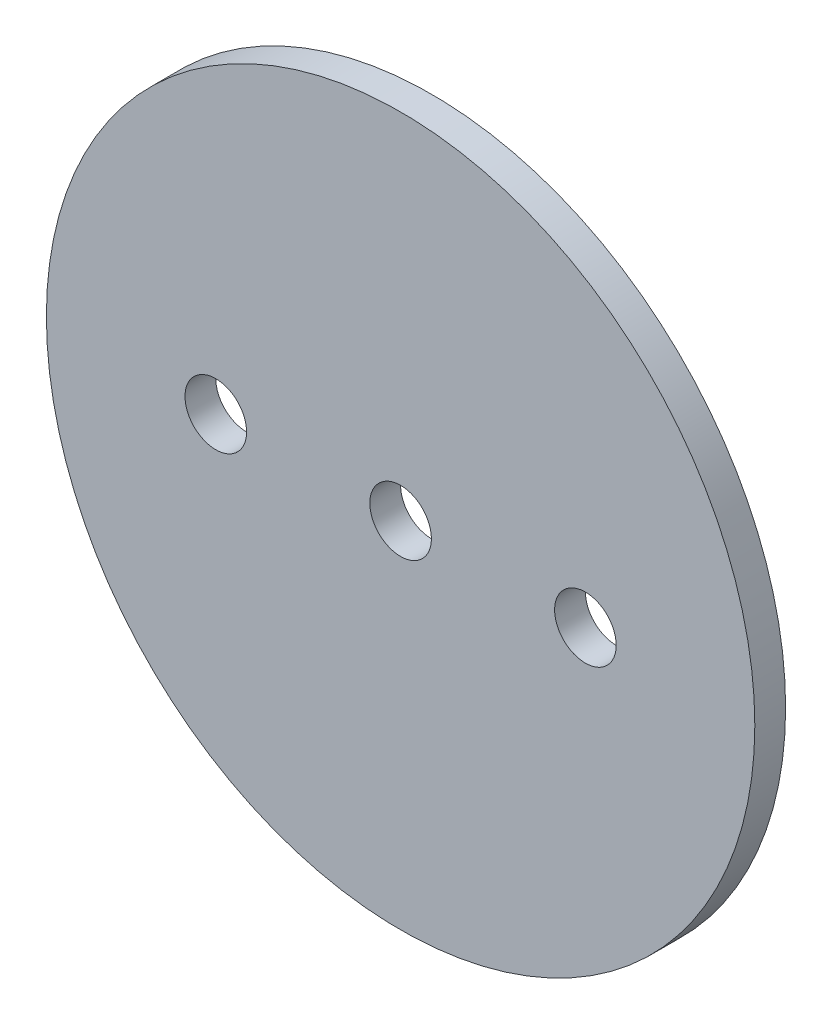
from build123d import *

# Parameters (mm, degrees)
SKETCH1_R                   = 36.5125
BOSS_EXTRUDE1_DEPTH         = 1.5875
F_1_4_0_25_DIAMETER_HOLE1_D = 6.35


with BuildPart() as part:
    # Sketch1 → Boss-Extrude1 (new, symmetric)
    with BuildSketch(Plane.XY):
        Circle(SKETCH1_R)
    extrude(amount=BOSS_EXTRUDE1_DEPTH, both=True)

    # 1/4 (0.25) Diameter Hole1 (through all)
    with Locations(Plane.XY.offset(1.5875)):
        with Locations((-19.05, 0), (0, 0), (19.05, 0)):
            Hole(F_1_4_0_25_DIAMETER_HOLE1_D / 2)


solid = part.part
